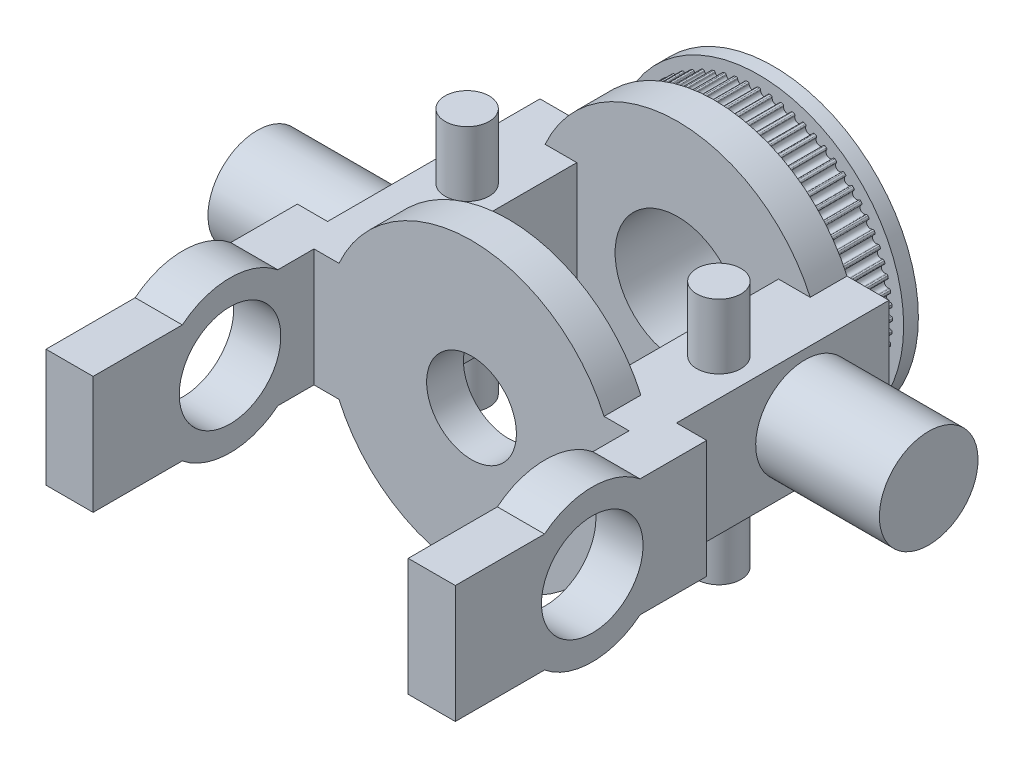
from build123d import *

# Parameters (mm, degrees)
SKETCH2_R         = 90.99
EXTRUDE1_DEPTH    = 30
EXTRUDE2_DEPTH    = 30
CIRPATTERN1_COUNT = 72
SKETCH3_R         = 98.5
EXTRUDE3_DEPTH    = 25
EXTRUDE4_START    = 10
SKETCH4_R         = 98.5
EXTRUDE4_DEPTH    = 10
SKETCH7_W         = 50
SKETCH7_H         = 80
EXTRUDE7_DEPTH    = 140
EXTRUDE8_START    = 25
EXTRUDE8_DEPTH    = 25
EXTRUDE9_START    = -25
EXTRUDE9_DEPTH    = 25
EXTRUDE10_REACH   = 258.456
SKETCH10_R        = 42.5
SKETCH12_W        = 32
SKETCH12_H        = 80
EXTRUDE12_DEPTH   = 150
SKETCH13_R        = 33.5
EXTRUDE13_DEPTH   = 84
SKETCH14_R        = 33.5
EXTRUDE14_DEPTH   = 84
EXTRUDE16_DEPTH   = 32
SKETCH17_R        = 34.5
EXTRUDE17_DEPTH   = 496.327669326
SKETCH19_R        = 15
EXTRUDE18_DEPTH   = 44
EXTRUDE19_REACH   = 306.522
SKETCH20_R        = 30.5
EXTRUDE20_DEPTH   = 20.5
SKETCH25_W        = 20.5
SKETCH25_H        = 20.723285706
EXTRUDE22_DEPTH   = 80


with BuildPart() as part:
    # Sketch2 → Extrude1 (new body)
    with BuildSketch(Plane.XY):
        Circle(SKETCH2_R)
    extrude(amount=EXTRUDE1_DEPTH)

    # Sketch1 → Extrude2 (cut)
    with BuildSketch(Plane.XY):
        with BuildLine():
            Line((-1.322286912, 90.269553646), (-1.364539703, 89.732681031))
            ThreePointArc((-1.364539703, 89.732681031), (-3.814515425, 87.366766977), (-6.461371247, 89.51014856))
            Line((-6.461371247, 89.51014856), (-6.550254785, 90.041295639))
            ThreePointArc((-6.550254785, 90.041295639), (-6.8401683, 90.527851886), (-7.382846046, 90.689986681))
            ThreePointArc((-7.382846046, 90.689986681), (-3.968928056, 90.903397682), (-0.549401061, 90.988341333))
            ThreePointArc((-0.549401061, 90.988341333), (-1.075882776, 90.779526028), (-1.322286912, 90.269553646))
        make_face()
    extrude2 = extrude(amount=EXTRUDE2_DEPTH, mode=Mode.SUBTRACT)

    # CirPattern1: Extrude2 ×72 about axis
    cirpattern1_axis = Axis((0, 0, 0), (0, 0, 1))
    for i in range(1, CIRPATTERN1_COUNT):
        add(extrude2.rotate(cirpattern1_axis, i * 360 / CIRPATTERN1_COUNT), mode=Mode.SUBTRACT)

    # Sketch3 → Extrude3 (add)
    with BuildSketch(Plane.XY.offset(30)):
        Circle(SKETCH3_R)
    extrude(amount=EXTRUDE3_DEPTH)

    # Sketch4 → Extrude4 (add)
    with BuildSketch(Plane(origin=(0, 0, 0), x_dir=(-1, 0, 0), z_dir=(0, 0, -1)).offset(EXTRUDE4_START)):
        with Locations(Location((0, 0, 0), (0, 0, 180))):
            Circle(SKETCH4_R)
    extrude(amount=-EXTRUDE4_DEPTH)

    # Sketch7 → Extrude7 (add)
    with BuildSketch(Plane.XY.offset(55)):
        with Locations((-93.5, 0)):
            Rectangle(SKETCH7_W, SKETCH7_H)
        with Locations((93.5, 0)):
            Rectangle(SKETCH7_W, SKETCH7_H)
    extrude(amount=EXTRUDE7_DEPTH)

    # Sketch8 → Extrude8 (add)
    with BuildSketch(Plane(origin=(0, 0, 55), x_dir=(-1, 0, 0), z_dir=(0, 0, -1)).offset(EXTRUDE8_START)):
        with BuildLine():
            Line((118.5, 40), (90.012499132, 40))
            ThreePointArc((90.012499132, 40), (98.5, 0), (90.012499132, -40))
            Line((90.012499132, -40), (118.5, -40))
            Line((118.5, -40), (118.5, 40))
        make_face()
        with BuildLine():
            Line((-90.012499132, 40), (-118.5, 40))
            Line((-118.5, 40), (-118.5, -40))
            Line((-118.5, -40), (-90.012499132, -40))
            ThreePointArc((-90.012499132, -40), (-98.5, 0), (-90.012499132, 40))
        make_face()
    extrude(amount=-EXTRUDE8_DEPTH)

    # Sketch9 → Extrude9 (add)
    with BuildSketch(Plane.XY.offset(195).offset(EXTRUDE9_START)):
        with BuildLine():
            Line((68.5, -40), (68.5, 40))
            Line((68.5, 40), (90.012499132, 40))
            ThreePointArc((90.012499132, 40), (0, 98.5), (-90.012499132, 40))
            Line((-90.012499132, 40), (-68.5, 40))
            Line((-68.5, 40), (-68.5, -40))
            Line((-68.5, -40), (-90.012499132, -40))
            ThreePointArc((-90.012499132, -40), (0, -98.5), (90.012499132, -40))
            Line((90.012499132, -40), (68.5, -40))
        make_face()
    extrude(amount=EXTRUDE9_DEPTH)

    # Sketch10 → Extrude10 (cut, up to next)
    with BuildSketch(Plane.XY.offset(-10), mode=Mode.PRIVATE) as extrude10_sk1:
        Circle(SKETCH10_R)
    extrude10_tool1 = extrude(extrude10_sk1.sketch, amount=EXTRUDE10_REACH, mode=Mode.PRIVATE) & part.part
    add(extrude10_tool1.solids().sort_by_distance((0, 0, -10))[0], mode=Mode.SUBTRACT)

    # Sketch12 → Extrude12 (add)
    with BuildSketch(Plane.XY.offset(195)):
        with Locations((123, 0)):
            Rectangle(SKETCH12_W, SKETCH12_H)
        with Locations((-123, 0)):
            Rectangle(SKETCH12_W, SKETCH12_H)
    extrude(amount=EXTRUDE12_DEPTH)

    # Sketch13 → Extrude13 (add)
    with BuildSketch(Plane.ZY.offset(118.5)):
        with Locations(Location((138, 0, 0), (0, 0, 90))):
            Circle(SKETCH13_R)
    extrude(amount=EXTRUDE13_DEPTH)

    # Sketch14 → Extrude14 (add)
    with BuildSketch(Plane(origin=(118.5, 0, 0), x_dir=(0, 0, -1), z_dir=(1, 0, 0))):
        with Locations(Location((-87, 0, 0), (0, 0, 270))):
            Circle(SKETCH14_R)
    extrude(amount=EXTRUDE14_DEPTH)

    # Sketch16 → Extrude16 (add)
    with BuildSketch(Plane.ZY.offset(139)):
        with BuildLine():
            Line((219.561596833, 40), (284.438403167, 40))
            ThreePointArc((284.438403167, 40), (252, 51.5), (219.561596833, 40))
        make_face()
        with BuildLine():
            Line((284.438403167, -40), (219.561596833, -40))
            ThreePointArc((219.561596833, -40), (252, -51.5), (284.438403167, -40))
        make_face()
    extrude16 = extrude(amount=-EXTRUDE16_DEPTH)

    # Mirror1: Extrude16 across plane
    add(extrude16.mirror(Plane(origin=(0, 0, 0), x_dir=(0, 0, 1), z_dir=(1, 0, 0))))

    # Sketch17 → Extrude17 (cut, through all)
    with BuildSketch(Plane.ZY.offset(139)):
        with Locations((252, 0)):
            Circle(SKETCH17_R)
    extrude(amount=-EXTRUDE17_DEPTH, mode=Mode.SUBTRACT)

    # Sketch19 → Extrude18 (add)
    with BuildSketch(Plane(origin=(0, 40, 0), x_dir=(1, 0, 0), z_dir=(0, 1, 0))):
        with Locations(Location((-93.5, -104.5, 0), (0, 0, 90))):
            Circle(SKETCH19_R)
        with Locations(Location((93.5, -120.5, 0), (0, 0, 90))):
            Circle(SKETCH19_R)
    extrude18 = extrude(amount=EXTRUDE18_DEPTH)

    # Sketch20 → Extrude19 (cut, up to next)
    with BuildSketch(Plane.XY.offset(195), mode=Mode.PRIVATE) as extrude19_sk1:
        Circle(SKETCH20_R)
    extrude19_tool1 = extrude(extrude19_sk1.sketch, amount=-EXTRUDE19_REACH, mode=Mode.PRIVATE) & part.part
    add(extrude19_tool1.solids().sort_by_distance((0, 0, 195))[0], mode=Mode.SUBTRACT)

    # Sketch23 → Extrude20 (add)
    with BuildSketch(Plane.ZY.offset(118.5)):
        with BuildLine():
            Line((195, 40), (174.276714294, 40))
            ThreePointArc((174.276714294, 40), (192, 0), (174.276714294, -40))
            Line((174.276714294, -40), (195, -40))
            Line((195, -40), (195, 40))
        make_face()
    extrude(amount=EXTRUDE20_DEPTH)

    # Sketch25 → Extrude22 (add)
    with BuildSketch(Plane(origin=(0, 40, 0), x_dir=(1, 0, 0), z_dir=(0, 1, 0))):
        with Locations((128.75, -184.638357147)):
            Rectangle(SKETCH25_W, SKETCH25_H)
    extrude(amount=-EXTRUDE22_DEPTH)

    # Mirror2: Extrude18 across plane
    add(extrude18.mirror(Plane.ZX))


solid = part.part
